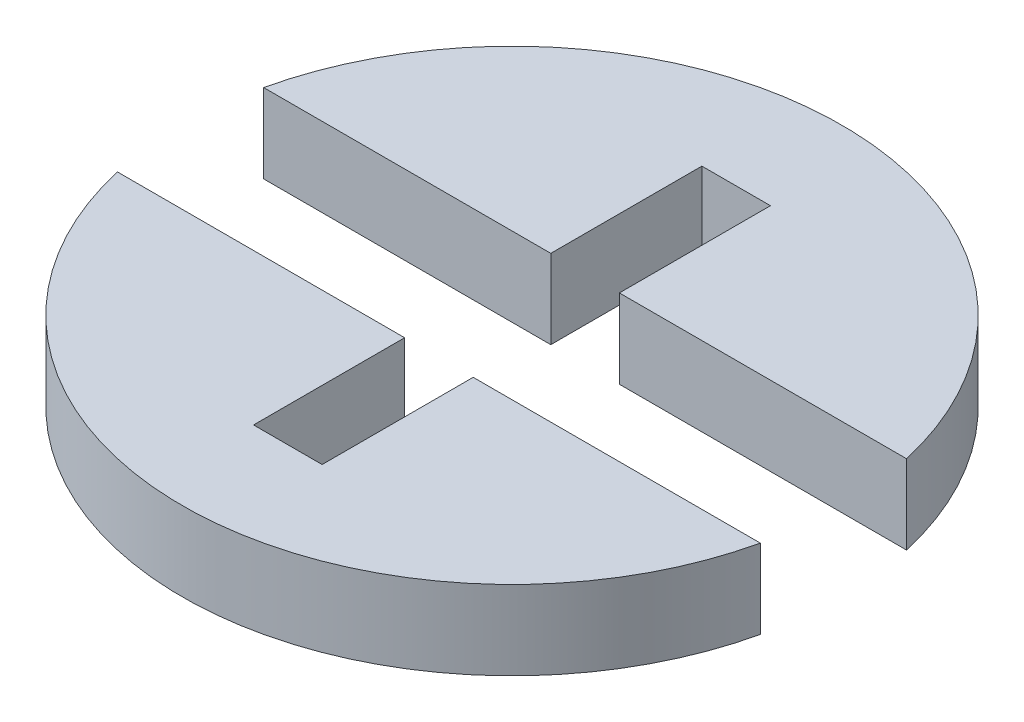
from build123d import *

# Parameters (mm, degrees)
BOSS_EXTRUDE1_DEPTH      = 1.5
BOSS_EXTRUDE1_DEPTH_BACK = 1.5
SKETCH1_R                = 12.5
SKETCH1_W                = 2.6
SKETCH1_H                = 17
CUT_EXTRUDE1_DEPTH       = 18.741194999
CUT_EXTRUDE1_DEPTH_BACK  = 18.741194999


with BuildPart() as part:
    # Sketch1 → Boss-Extrude1 (new, two sides: drawn at the far end of the back side and taken through both)
    with BuildSketch(Plane(origin=(0, 0, 0), x_dir=(1, 0, 0), z_dir=(0, 1, 0)).offset(-BOSS_EXTRUDE1_DEPTH_BACK)):
        Circle(SKETCH1_R)
        Rectangle(SKETCH1_W, SKETCH1_H, mode=Mode.SUBTRACT)
    extrude(amount=BOSS_EXTRUDE1_DEPTH + BOSS_EXTRUDE1_DEPTH_BACK)

    # Sketch4 → Cut-Extrude1 (cut, two sides: drawn at the far end of the back side and taken through both)
    with BuildSketch(Plane(origin=(0, 0, 0), x_dir=(0, 0, -1), z_dir=(1, 0, 0)).offset(-CUT_EXTRUDE1_DEPTH_BACK)):
        Polygon((2.771281292, -1.6), (2.771281292, 1.6), (0, 3.2), (-2.771281292, 1.6), (-2.771281292, -1.6), (0, -3.2), align=None)
    extrude(amount=CUT_EXTRUDE1_DEPTH + CUT_EXTRUDE1_DEPTH_BACK, mode=Mode.SUBTRACT)


with BuildPart() as cut_extrude1_piece_1:
    # of the separate pieces the step leaves, piece 1, a body of its own (cut_extrude1_pieces)
    add(part.part.solids().sort_by_distance((-12.188929403, -1.5, -2.771281292))[0])


with BuildPart() as cut_extrude1_piece_2:
    # of the separate pieces the step leaves, piece 2, a body of its own (cut_extrude1_pieces)
    add(part.part.solids().sort_by_distance((-12.188929403, 1.5, 2.771281292))[0])


solid = Compound([cut_extrude1_piece_1.part, cut_extrude1_piece_2.part])
